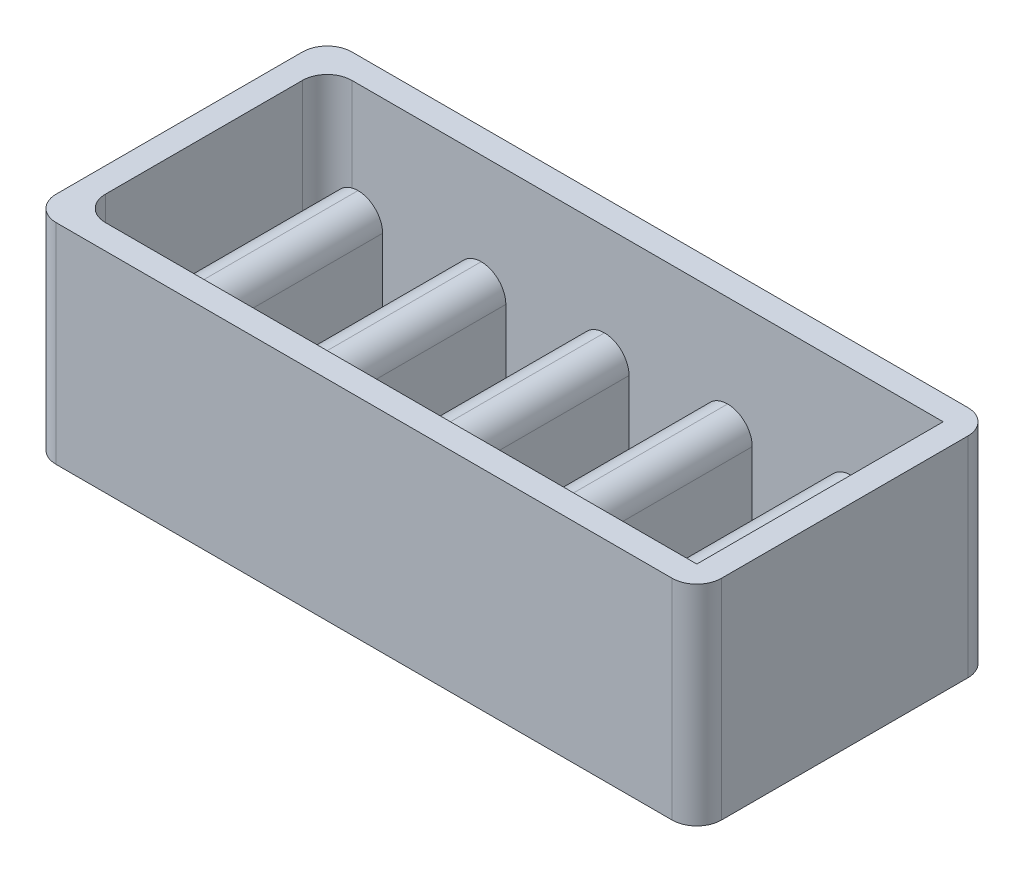
from build123d import *

# Parameters (mm, degrees)
CROQUIS7_W               = 54
CROQUIS7_H               = 24
CROQUIS7_W_2             = 50
CROQUIS7_H_2             = 20
SALIENTE_EXTRUIR7_DEPTH  = 15
CROQUIS8_W               = 54
CROQUIS8_H               = 24
SALIENTE_EXTRUIR8_DEPTH  = 2
CROQUIS9_W               = 4
CROQUIS9_H               = 15
SALIENTE_EXTRUIR10_DEPTH = 10
MATRIZL1_COUNT           = 5
MATRIZL1_PITCH           = 10
CROQUIS10_W              = 47
CROQUIS10_H              = 3.83204255
SALIENTE_EXTRUIR11_DEPTH = 3
REDONDEO1_R              = 2
REDONDEO2_R              = 2
REDONDEO3_R              = 2
REDONDEO4_R              = 2


# Some blends are built 0.0001 mm under size
with BuildPart() as part:
    # Croquis7 → Saliente-Extruir7 (new body)
    with BuildSketch(Plane(origin=(0, 0, 0), x_dir=(1, 0, 0), z_dir=(0, 1, 0))):
        Rectangle(CROQUIS7_W, CROQUIS7_H)
        Rectangle(CROQUIS7_W_2, CROQUIS7_H_2, mode=Mode.SUBTRACT)
    extrude(amount=SALIENTE_EXTRUIR7_DEPTH)

    # Croquis8 → Saliente-Extruir8 (add)
    with BuildSketch(Plane.XZ):
        Rectangle(CROQUIS8_W, CROQUIS8_H)
    extrude(amount=SALIENTE_EXTRUIR8_DEPTH)

    # Croquis9 → Saliente-Extruir10 (add)
    with BuildSketch(Plane(origin=(0, 0, 0), x_dir=(1, 0, 0), z_dir=(0, 1, 0))):
        with Locations((-20, 0)):
            Rectangle(CROQUIS9_W, CROQUIS9_H)
    saliente_extruir10 = extrude(amount=SALIENTE_EXTRUIR10_DEPTH)

    # MatrizL1: Saliente-Extruir10 ×5
    with Locations(*[(i * MATRIZL1_PITCH, 0, 0) for i in range(1, MATRIZL1_COUNT)]):
        add(saliente_extruir10)

    # Croquis10 → Saliente-Extruir11 (add)
    with BuildSketch(Plane(origin=(0, 0, 0), x_dir=(1, 0, 0), z_dir=(0, 1, 0))):
        with Locations((1.5, 0)):
            Rectangle(CROQUIS10_W, CROQUIS10_H)
    extrude(amount=SALIENTE_EXTRUIR11_DEPTH)

    # Redondeo1
    # the kernel refuses this fillet: 2 mm, written as the material it takes off along each edge
    with BuildSketch(Plane(origin=(25, 3, 1.916021275), x_dir=(0, 0, -1), z_dir=(-1, 0, 0))) as redondeo1_piece_1:
        with BuildLine():
            CenterArc((REDONDEO1_R, REDONDEO1_R), REDONDEO1_R, 180, 90)
            Line((0, REDONDEO1_R), (0, 0))
            Line((0, 0), (REDONDEO1_R, 0))
        make_face()
    extrude(amount=3, mode=Mode.SUBTRACT)
    with BuildSketch(Plane(origin=(30, 3, 1.916021275), x_dir=(0, 0, -1), z_dir=(-1, 0, 0))) as redondeo1_piece_2_section:
        with BuildLine():
            CenterArc((REDONDEO1_R, REDONDEO1_R), REDONDEO1_R, 180, 90)
            Line((0, REDONDEO1_R), (0, 0))
            Line((0, 0), (REDONDEO1_R, 0))
        make_face()
    redondeo1_piece_2 = extrude(amount=13, mode=Mode.PRIVATE)
    redondeo1_piece_2 = split(redondeo1_piece_2, bisect_by=Plane(origin=(18, 2.553264122, 1.469285397), z_dir=(-1, 0, 0)), keep=Keep.TOP, mode=Mode.PRIVATE)
    add(redondeo1_piece_2, mode=Mode.SUBTRACT)
    with BuildSketch(Plane(origin=(17, 3, -1.916021275), x_dir=(0, -1, 0), z_dir=(1, 0, 0))) as redondeo1_piece_3_section:
        with BuildLine():
            CenterArc((REDONDEO1_R, -REDONDEO1_R), REDONDEO1_R, 90, 90)
            Line((0, -REDONDEO1_R), (0, 0))
            Line((0, 0), (REDONDEO1_R, 0))
        make_face()
    redondeo1_piece_3 = extrude(amount=13, mode=Mode.PRIVATE)
    redondeo1_piece_3 = split(redondeo1_piece_3, bisect_by=Plane(origin=(18, 2.553264122, -1.469285397), z_dir=(-1, 0, 0)), keep=Keep.TOP, mode=Mode.PRIVATE)
    add(redondeo1_piece_3, mode=Mode.SUBTRACT)
    with BuildSketch(Plane(origin=(22, 3, -1.916021275), x_dir=(0, -1, 0), z_dir=(1, 0, 0))) as redondeo1_piece_4:
        with BuildLine():
            CenterArc((REDONDEO1_R, -REDONDEO1_R), REDONDEO1_R, 90, 90)
            Line((0, -REDONDEO1_R), (0, 0))
            Line((0, 0), (REDONDEO1_R, 0))
        make_face()
    extrude(amount=3, mode=Mode.SUBTRACT)
    with BuildSketch(Plane(origin=(7, 3, -1.916021275), x_dir=(0, -1, 0), z_dir=(1, 0, 0))) as redondeo1_piece_5_section:
        with BuildLine():
            CenterArc((REDONDEO1_R, -REDONDEO1_R), REDONDEO1_R, 90, 90)
            Line((0, -REDONDEO1_R), (0, 0))
            Line((0, 0), (REDONDEO1_R, 0))
        make_face()
    redondeo1_piece_5 = extrude(amount=16, mode=Mode.PRIVATE)
    redondeo1_piece_5 = split(redondeo1_piece_5, bisect_by=Plane(origin=(8, 2.553264122, -1.469285397), z_dir=(-1, 0, 0)), keep=Keep.TOP, mode=Mode.PRIVATE)
    add(redondeo1_piece_5, mode=Mode.SUBTRACT)
    with BuildSketch(Plane(origin=(12, 3, -1.916021275), x_dir=(0, -1, 0), z_dir=(1, 0, 0)), Plane(origin=(2, 3, -1.916021275), x_dir=(0, -1, 0), z_dir=(1, 0, 0)), Plane(origin=(-8, 3, -1.916021275), x_dir=(0, -1, 0), z_dir=(1, 0, 0)), Plane(origin=(-18, 3, -1.916021275), x_dir=(0, -1, 0), z_dir=(1, 0, 0))) as redondeo1_piece_6:
        with BuildLine():
            CenterArc((REDONDEO1_R, -REDONDEO1_R), REDONDEO1_R, 90, 90)
            Line((0, -REDONDEO1_R), (0, 0))
            Line((0, 0), (REDONDEO1_R, 0))
        make_face()
    extrude(amount=6, mode=Mode.SUBTRACT)
    with BuildSketch(Plane(origin=(7, 3, -1.916021275), x_dir=(0, -1, 0), z_dir=(1, 0, 0))) as redondeo1_piece_7_section:
        with BuildLine():
            CenterArc((REDONDEO1_R, -REDONDEO1_R), REDONDEO1_R, 90, 90)
            Line((0, -REDONDEO1_R), (0, 0))
            Line((0, 0), (REDONDEO1_R, 0))
        make_face()
    redondeo1_piece_7 = extrude(amount=16, mode=Mode.PRIVATE)
    redondeo1_piece_7 = split(redondeo1_piece_7, bisect_by=Plane(origin=(22, 2.553264122, -1.469285397), z_dir=(1, 0, 0)), keep=Keep.TOP, mode=Mode.PRIVATE)
    add(redondeo1_piece_7, mode=Mode.SUBTRACT)
    with BuildSketch(Plane(origin=(23, 3, 1.916021275), x_dir=(0, 0, -1), z_dir=(-1, 0, 0))) as redondeo1_piece_8_section:
        with BuildLine():
            CenterArc((REDONDEO1_R, REDONDEO1_R), REDONDEO1_R, 180, 90)
            Line((0, REDONDEO1_R), (0, 0))
            Line((0, 0), (REDONDEO1_R, 0))
        make_face()
    redondeo1_piece_8 = extrude(amount=16, mode=Mode.PRIVATE)
    redondeo1_piece_8 = split(redondeo1_piece_8, bisect_by=Plane(origin=(22, 2.553264122, 1.469285397), z_dir=(1, 0, 0)), keep=Keep.TOP, mode=Mode.PRIVATE)
    add(redondeo1_piece_8, mode=Mode.SUBTRACT)
    with BuildSketch(Plane(origin=(18, 3, 1.916021275), x_dir=(0, 0, -1), z_dir=(-1, 0, 0)), Plane(origin=(8, 3, 1.916021275), x_dir=(0, 0, -1), z_dir=(-1, 0, 0)), Plane(origin=(-2, 3, 1.916021275), x_dir=(0, 0, -1), z_dir=(-1, 0, 0)), Plane(origin=(-12, 3, 1.916021275), x_dir=(0, 0, -1), z_dir=(-1, 0, 0))) as redondeo1_piece_9:
        with BuildLine():
            CenterArc((REDONDEO1_R, REDONDEO1_R), REDONDEO1_R, 180, 90)
            Line((0, REDONDEO1_R), (0, 0))
            Line((0, 0), (REDONDEO1_R, 0))
        make_face()
    extrude(amount=6, mode=Mode.SUBTRACT)
    with BuildSketch(Plane(origin=(23, 3, 1.916021275), x_dir=(0, 0, -1), z_dir=(-1, 0, 0))) as redondeo1_piece_10_section:
        with BuildLine():
            CenterArc((REDONDEO1_R, REDONDEO1_R), REDONDEO1_R, 180, 90)
            Line((0, REDONDEO1_R), (0, 0))
            Line((0, 0), (REDONDEO1_R, 0))
        make_face()
    redondeo1_piece_10 = extrude(amount=16, mode=Mode.PRIVATE)
    redondeo1_piece_10 = split(redondeo1_piece_10, bisect_by=Plane(origin=(8, 2.553264122, 1.469285397), z_dir=(-1, 0, 0)), keep=Keep.TOP, mode=Mode.PRIVATE)
    add(redondeo1_piece_10, mode=Mode.SUBTRACT)
    with BuildSketch(Plane(origin=(13, 3, 1.916021275), x_dir=(0, 0, -1), z_dir=(-1, 0, 0))) as redondeo1_piece_11_section:
        with BuildLine():
            CenterArc((REDONDEO1_R, REDONDEO1_R), REDONDEO1_R, 180, 90)
            Line((0, REDONDEO1_R), (0, 0))
            Line((0, 0), (REDONDEO1_R, 0))
        make_face()
    redondeo1_piece_11 = extrude(amount=16, mode=Mode.PRIVATE)
    redondeo1_piece_11 = split(redondeo1_piece_11, bisect_by=Plane(origin=(12, 2.553264122, 1.469285397), z_dir=(1, 0, 0)), keep=Keep.TOP, mode=Mode.PRIVATE)
    add(redondeo1_piece_11, mode=Mode.SUBTRACT)
    with BuildSketch(Plane(origin=(13, 3, 1.916021275), x_dir=(0, 0, -1), z_dir=(-1, 0, 0))) as redondeo1_piece_12_section:
        with BuildLine():
            CenterArc((REDONDEO1_R, REDONDEO1_R), REDONDEO1_R, 180, 90)
            Line((0, REDONDEO1_R), (0, 0))
            Line((0, 0), (REDONDEO1_R, 0))
        make_face()
    redondeo1_piece_12 = extrude(amount=16, mode=Mode.PRIVATE)
    redondeo1_piece_12 = split(redondeo1_piece_12, bisect_by=Plane(origin=(-2, 2.553264122, 1.469285397), z_dir=(-1, 0, 0)), keep=Keep.TOP, mode=Mode.PRIVATE)
    add(redondeo1_piece_12, mode=Mode.SUBTRACT)
    with BuildSketch(Plane(origin=(-3, 3, -1.916021275), x_dir=(0, -1, 0), z_dir=(1, 0, 0))) as redondeo1_piece_13_section:
        with BuildLine():
            CenterArc((REDONDEO1_R, -REDONDEO1_R), REDONDEO1_R, 90, 90)
            Line((0, -REDONDEO1_R), (0, 0))
            Line((0, 0), (REDONDEO1_R, 0))
        make_face()
    redondeo1_piece_13 = extrude(amount=16, mode=Mode.PRIVATE)
    redondeo1_piece_13 = split(redondeo1_piece_13, bisect_by=Plane(origin=(-2, 2.553264122, -1.469285397), z_dir=(-1, 0, 0)), keep=Keep.TOP, mode=Mode.PRIVATE)
    add(redondeo1_piece_13, mode=Mode.SUBTRACT)
    with BuildSketch(Plane(origin=(-3, 3, -1.916021275), x_dir=(0, -1, 0), z_dir=(1, 0, 0))) as redondeo1_piece_14_section:
        with BuildLine():
            CenterArc((REDONDEO1_R, -REDONDEO1_R), REDONDEO1_R, 90, 90)
            Line((0, -REDONDEO1_R), (0, 0))
            Line((0, 0), (REDONDEO1_R, 0))
        make_face()
    redondeo1_piece_14 = extrude(amount=16, mode=Mode.PRIVATE)
    redondeo1_piece_14 = split(redondeo1_piece_14, bisect_by=Plane(origin=(12, 2.553264122, -1.469285397), z_dir=(1, 0, 0)), keep=Keep.TOP, mode=Mode.PRIVATE)
    add(redondeo1_piece_14, mode=Mode.SUBTRACT)
    with BuildSketch(Plane(origin=(3, 3, 1.916021275), x_dir=(0, 0, -1), z_dir=(-1, 0, 0))) as redondeo1_piece_15_section:
        with BuildLine():
            CenterArc((REDONDEO1_R, REDONDEO1_R), REDONDEO1_R, 180, 90)
            Line((0, REDONDEO1_R), (0, 0))
            Line((0, 0), (REDONDEO1_R, 0))
        make_face()
    redondeo1_piece_15 = extrude(amount=16, mode=Mode.PRIVATE)
    redondeo1_piece_15 = split(redondeo1_piece_15, bisect_by=Plane(origin=(2, 2.553264122, 1.469285397), z_dir=(1, 0, 0)), keep=Keep.TOP, mode=Mode.PRIVATE)
    add(redondeo1_piece_15, mode=Mode.SUBTRACT)
    with BuildSketch(Plane(origin=(3, 3, 1.916021275), x_dir=(0, 0, -1), z_dir=(-1, 0, 0))) as redondeo1_piece_16_section:
        with BuildLine():
            CenterArc((REDONDEO1_R, REDONDEO1_R), REDONDEO1_R, 180, 90)
            Line((0, REDONDEO1_R), (0, 0))
            Line((0, 0), (REDONDEO1_R, 0))
        make_face()
    redondeo1_piece_16 = extrude(amount=16, mode=Mode.PRIVATE)
    redondeo1_piece_16 = split(redondeo1_piece_16, bisect_by=Plane(origin=(-12, 2.553264122, 1.469285397), z_dir=(-1, 0, 0)), keep=Keep.TOP, mode=Mode.PRIVATE)
    add(redondeo1_piece_16, mode=Mode.SUBTRACT)
    with BuildSketch(Plane(origin=(-13, 3, -1.916021275), x_dir=(0, -1, 0), z_dir=(1, 0, 0))) as redondeo1_piece_17_section:
        with BuildLine():
            CenterArc((REDONDEO1_R, -REDONDEO1_R), REDONDEO1_R, 90, 90)
            Line((0, -REDONDEO1_R), (0, 0))
            Line((0, 0), (REDONDEO1_R, 0))
        make_face()
    redondeo1_piece_17 = extrude(amount=16, mode=Mode.PRIVATE)
    redondeo1_piece_17 = split(redondeo1_piece_17, bisect_by=Plane(origin=(-12, 2.553264122, -1.469285397), z_dir=(-1, 0, 0)), keep=Keep.TOP, mode=Mode.PRIVATE)
    add(redondeo1_piece_17, mode=Mode.SUBTRACT)
    with BuildSketch(Plane(origin=(-13, 3, -1.916021275), x_dir=(0, -1, 0), z_dir=(1, 0, 0))) as redondeo1_piece_18_section:
        with BuildLine():
            CenterArc((REDONDEO1_R, -REDONDEO1_R), REDONDEO1_R, 90, 90)
            Line((0, -REDONDEO1_R), (0, 0))
            Line((0, 0), (REDONDEO1_R, 0))
        make_face()
    redondeo1_piece_18 = extrude(amount=16, mode=Mode.PRIVATE)
    redondeo1_piece_18 = split(redondeo1_piece_18, bisect_by=Plane(origin=(2, 2.553264122, -1.469285397), z_dir=(1, 0, 0)), keep=Keep.TOP, mode=Mode.PRIVATE)
    add(redondeo1_piece_18, mode=Mode.SUBTRACT)
    with BuildSketch(Plane(origin=(-23, 3, -1.916021275), x_dir=(0, -1, 0), z_dir=(1, 0, 0))) as redondeo1_piece_19_section:
        with BuildLine():
            CenterArc((REDONDEO1_R, -REDONDEO1_R), REDONDEO1_R, 90, 90)
            Line((0, -REDONDEO1_R), (0, 0))
            Line((0, 0), (REDONDEO1_R, 0))
        make_face()
    redondeo1_piece_19 = extrude(amount=16, mode=Mode.PRIVATE)
    redondeo1_piece_19 = split(redondeo1_piece_19, bisect_by=Plane(origin=(-8, 2.553264122, -1.469285397), z_dir=(1, 0, 0)), keep=Keep.TOP, mode=Mode.PRIVATE)
    add(redondeo1_piece_19, mode=Mode.SUBTRACT)
    with BuildSketch(Plane(origin=(-7, 3, 1.916021275), x_dir=(0, 0, -1), z_dir=(-1, 0, 0))) as redondeo1_piece_20_section:
        with BuildLine():
            CenterArc((REDONDEO1_R, REDONDEO1_R), REDONDEO1_R, 180, 90)
            Line((0, REDONDEO1_R), (0, 0))
            Line((0, 0), (REDONDEO1_R, 0))
        make_face()
    redondeo1_piece_20 = extrude(amount=16, mode=Mode.PRIVATE)
    redondeo1_piece_20 = split(redondeo1_piece_20, bisect_by=Plane(origin=(-8, 2.553264122, 1.469285397), z_dir=(1, 0, 0)), keep=Keep.TOP, mode=Mode.PRIVATE)
    add(redondeo1_piece_20, mode=Mode.SUBTRACT)

    # Redondeo2
    redondeo2_edges = [part.edges().sort_by_distance(p)[0] for p in [
        (-25, 7.5, -10),
        (-25, 7.5, 10),
    ]]
    fillet(redondeo2_edges, radius=REDONDEO2_R)

    # Redondeo3
    redondeo3_edges = [part.edges().sort_by_distance(p)[0] for p in [
        (22, 10, 0),
        (18, 10, 0),
        (12, 10, 0),
        (8, 10, 0),
        (2, 10, 0),
        (-18, 10, 0),
        (-22, 10, 0),
        (-12, 10, 0),
        (-2, 10, 0),
        (-8, 10, 0),
    ]]
    fillet(redondeo3_edges, radius=REDONDEO3_R - 0.0001)  # a hair under: the kernel refuses the full size

    # Redondeo4
    redondeo4_edges = [part.edges().sort_by_distance(p)[0] for p in [
        (27, 6.5, 12),
        (-27, 6.5, 12),
        (-27, 6.5, -12),
        (27, 6.5, -12),
    ]]
    fillet(redondeo4_edges, radius=REDONDEO4_R)


solid = part.part
